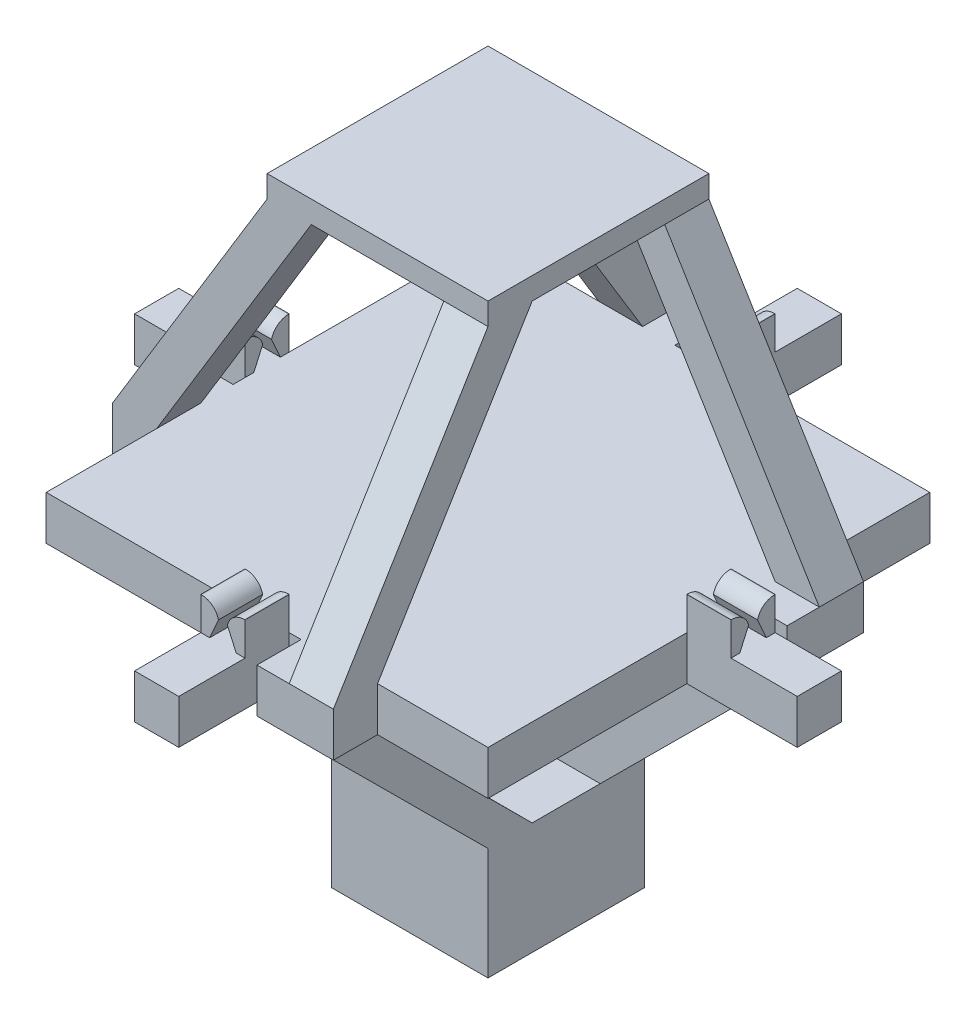
from build123d import *

# Parameters (mm, degrees)
SKETCH2_W            = 100
SKETCH2_H            = 100
BOSS_EXTRUDE1_DEPTH  = 5
SKETCH3_W            = 100
SKETCH3_H            = 100
BOSS_EXTRUDE2_DEPTH  = 5
SKETCH8_R            = 5
BOSS_EXTRUDE7_DEPTH  = 30
BOSS_EXTRUDE21_DEPTH = 10
FILLET14_R           = 4
FILLET13_R           = 4
SKETCH24_W           = 10
SKETCH24_H           = 10
BOSS_EXTRUDE22_DEPTH = 15
BOSS_EXTRUDE25_DEPTH = 10
SKETCH26_W           = 10
SKETCH26_H           = 10
BOSS_EXTRUDE26_DEPTH = 15
FILLET18_R           = 4
FILLET17_R           = 4
BOSS_EXTRUDE23_DEPTH = 10
SKETCH25_W           = 10
SKETCH25_H           = 10
BOSS_EXTRUDE24_DEPTH = 15
FILLET15_R           = 4
FILLET16_R           = 4
BOSS_EXTRUDE10_DEPTH = 10
FILLET19_R           = 4
SKETCH27_W           = 10
SKETCH27_H           = 10
BOSS_EXTRUDE27_DEPTH = 15
FILLET20_R           = 4
SKETCH62_R           = 11.223510807
CUT_EXTRUDE3_DEPTH   = 30
SKETCH64_W           = 35.4
SKETCH64_H           = 35.4
BOSS_EXTRUDE53_DEPTH = 25.4
SKETCH66_W           = 25.4
SKETCH66_H           = 25.4
CUT_EXTRUDE4_DEPTH   = 12.7
SKETCH67_W           = 50
SKETCH67_H           = 50
BOSS_EXTRUDE54_DEPTH = 5
SKETCH68_W           = 17.3
SKETCH68_H           = 10
BOSS_EXTRUDE55_DEPTH = 10
SKETCH70_W           = 17.3
SKETCH70_H           = 10
BOSS_EXTRUDE57_DEPTH = 10
SKETCH74_W           = 17.3
SKETCH74_H           = 10
BOSS_EXTRUDE58_DEPTH = 10
BOSS_EXTRUDE59_DEPTH = 10
BOSS_EXTRUDE60_DEPTH = 10
BOSS_EXTRUDE61_DEPTH = 10
BOSS_EXTRUDE62_DEPTH = 10
BOSS_EXTRUDE63_DEPTH = 10
BOSS_EXTRUDE64_DEPTH = 10
SKETCH85_W           = 17.3
SKETCH85_H           = 10
BOSS_EXTRUDE65_DEPTH = 10
BOSS_EXTRUDE66_DEPTH = 10
BOSS_EXTRUDE67_DEPTH = 10


with BuildPart() as part:
    # Sketch2 → Boss-Extrude1 (new body)
    with BuildSketch(Plane(origin=(0, 0, 0), x_dir=(1, 0, 0), z_dir=(0, 1, 0))):
        Rectangle(SKETCH2_W, SKETCH2_H)
    extrude(amount=BOSS_EXTRUDE1_DEPTH)

    # Sketch3 → Boss-Extrude2 (add)
    with BuildSketch(Plane.XZ):
        Rectangle(SKETCH3_W, SKETCH3_H)
    extrude(amount=BOSS_EXTRUDE2_DEPTH)

    # Sketch8 → Boss-Extrude7 (add)
    with BuildSketch(Plane.XZ.offset(5)):
        with Locations(Location((0, 0, 0), (0, 0, 90))):
            Circle(SKETCH8_R)
    extrude(amount=BOSS_EXTRUDE7_DEPTH)

    # Sketch11 → Boss-Extrude21 (add)
    with BuildSketch(Plane(origin=(50, 0, 0), x_dir=(0, 0, -1), z_dir=(1, 0, 0))):
        Polygon((5, -5), (5, 12.5), (1, 12.5), (1, 9.5), (3, 5), (-3, 5), (-1, 9.5), (-1, 12.5), (-5, 12.5), (-5, -5), align=None)
    extrude(amount=BOSS_EXTRUDE21_DEPTH)

    # Fillet14
    # the kernel refuses this fillet: 4 mm, written as the material it takes off along each edge
    with BuildSketch(Plane(origin=(40.317541634, 12.5, -1), x_dir=(0, -1, 0), z_dir=(1, 0, 0))) as fillet14_piece_1:
        with BuildLine():
            CenterArc((4, 3.872983346), FILLET14_R, 180, 75.522487814)
            Line((0, 3.872983346), (-0.08, 3.872983346))
            Line((-0.08, 3.872983346), (-0.08, 0))
            Line((-0.08, 0), (0, -0.08))
            ThreePointArc((0, -0.08), (1.5, -0.08), (2.98, -0.077459667))
            Line((2.98, -0.077459667), (3, 0))
        make_face()
    extrude(amount=29.364916731, mode=Mode.SUBTRACT)

    # Fillet13
    # the kernel refuses this fillet: 4 mm, written as the material it takes off along each edge
    with BuildSketch(Plane(origin=(40.317541634, 12.5, 1), x_dir=(0, 0, 1), z_dir=(1, 0, 0))) as fillet13_piece_1:
        with BuildLine():
            CenterArc((3.872983346, 4), FILLET13_R, 194.477512186, 75.522487814)
            Line((0, 3), (-0.077459667, 2.98))
            ThreePointArc((-0.077459667, 2.98), (-0.08, 1.5), (-0.08, 0))
            Line((-0.08, 0), (0, -0.08))
            Line((0, -0.08), (3.872983346, -0.08))
            Line((3.872983346, -0.08), (3.872983346, 0))
        make_face()
    extrude(amount=29.364916731, mode=Mode.SUBTRACT)

    # Sketch24 → Boss-Extrude22 (add)
    with BuildSketch(Plane(origin=(60, 0, 0), x_dir=(0, 0, -1), z_dir=(1, 0, 0))):
        Rectangle(SKETCH24_W, SKETCH24_H)
    extrude(amount=BOSS_EXTRUDE22_DEPTH)

    # Sketch13 → Boss-Extrude25 (add)
    with BuildSketch(Plane.ZY.offset(50)):
        Polygon((-5, 12.5), (-5, -5), (5, -5), (5, 12.5), (1, 12.5), (1, 9.5), (3, 5), (-3, 5), (-1, 9.5), (-1, 12.5), align=None)
    extrude(amount=BOSS_EXTRUDE25_DEPTH)

    # Sketch26 → Boss-Extrude26 (add)
    with BuildSketch(Plane.ZY.offset(60)):
        Rectangle(SKETCH26_W, SKETCH26_H)
    extrude(amount=BOSS_EXTRUDE26_DEPTH)

    # Fillet18
    # the kernel refuses this fillet: 4 mm, written as the material it takes off along each edge
    with BuildSketch(Plane(origin=(-40.317541634, 12.5, 1), x_dir=(0, -1, 0), z_dir=(-1, 0, 0))) as fillet18_piece_1:
        with BuildLine():
            CenterArc((4, 3.872983346), FILLET18_R, 180, 75.522487814)
            Line((0, 3.872983346), (-0.08, 3.872983346))
            Line((-0.08, 3.872983346), (-0.08, 0))
            Line((-0.08, 0), (0, -0.08))
            ThreePointArc((0, -0.08), (1.5, -0.08), (2.98, -0.077459667))
            Line((2.98, -0.077459667), (3, 0))
        make_face()
    extrude(amount=29.364916731, mode=Mode.SUBTRACT)

    # Fillet17
    # the kernel refuses this fillet: 4 mm, written as the material it takes off along each edge
    with BuildSketch(Plane(origin=(-40.317541634, 12.5, -1), x_dir=(0, 0, -1), z_dir=(-1, 0, 0))) as fillet17_piece_1:
        with BuildLine():
            CenterArc((3.872983346, 4), FILLET17_R, 194.477512186, 75.522487814)
            Line((0, 3), (-0.077459667, 2.98))
            ThreePointArc((-0.077459667, 2.98), (-0.08, 1.5), (-0.08, 0))
            Line((-0.08, 0), (0, -0.08))
            Line((0, -0.08), (3.872983346, -0.08))
            Line((3.872983346, -0.08), (3.872983346, 0))
        make_face()
    extrude(amount=29.364916731, mode=Mode.SUBTRACT)

    # Sketch14 → Boss-Extrude23 (add)
    with BuildSketch(Plane(origin=(0, 0, -50), x_dir=(-1, 0, 0), z_dir=(0, 0, -1))):
        Polygon((-5, 12.5), (-1, 12.5), (-1, 9.5), (-3, 5), (3, 5), (1, 9.5), (1, 12.5), (5, 12.5), (5, -5), (-5, -5), align=None)
    extrude(amount=BOSS_EXTRUDE23_DEPTH)

    # Sketch25 → Boss-Extrude24 (add)
    with BuildSketch(Plane(origin=(0, 0, -60), x_dir=(-1, 0, 0), z_dir=(0, 0, -1))):
        Rectangle(SKETCH25_W, SKETCH25_H)
    extrude(amount=BOSS_EXTRUDE24_DEPTH)

    # Fillet15
    # the kernel refuses this fillet: 4 mm, written as the material it takes off along each edge
    with BuildSketch(Plane(origin=(-1, 12.5, -40.317541634), x_dir=(0, -1, 0), z_dir=(0, 0, -1))) as fillet15_piece_1:
        with BuildLine():
            CenterArc((4, 3.872983346), FILLET15_R, 180, 75.522487814)
            Line((0, 3.872983346), (-0.08, 3.872983346))
            Line((-0.08, 3.872983346), (-0.08, 0))
            Line((-0.08, 0), (0, -0.08))
            ThreePointArc((0, -0.08), (1.5, -0.08), (2.98, -0.077459667))
            Line((2.98, -0.077459667), (3, 0))
        make_face()
    extrude(amount=29.364916731, mode=Mode.SUBTRACT)

    # Fillet16
    # the kernel refuses this fillet: 4 mm, written as the material it takes off along each edge
    with BuildSketch(Plane(origin=(1, 12.5, -40.317541634), x_dir=(0, -1, 0), z_dir=(0, 0, -1))) as fillet16_piece_1:
        with BuildLine():
            CenterArc((4, -3.872983346), FILLET16_R, 104.477512186, 75.522487814)
            Line((0, -3.872983346), (-0.08, -3.872983346))
            Line((-0.08, -3.872983346), (-0.08, 0))
            Line((-0.08, 0), (0, 0.08))
            ThreePointArc((0, 0.08), (1.5, 0.08), (2.98, 0.077459667))
            Line((2.98, 0.077459667), (3, 0))
        make_face()
    extrude(amount=29.364916731, mode=Mode.SUBTRACT)

    # Sketch12 → Boss-Extrude10 (add)
    with BuildSketch(Plane.XY.offset(50)):
        Polygon((-5, 12.5), (-5, -5), (5, -5), (5, 12.5), (1, 12.5), (1, 9.5), (3, 5), (-3, 5), (-1, 9.5), (-1, 12.5), align=None)
    extrude(amount=BOSS_EXTRUDE10_DEPTH)

    # Fillet19
    # the kernel refuses this fillet: 4 mm, written as the material it takes off along each edge
    with BuildSketch(Plane(origin=(-1, 12.5, 40.317541634), x_dir=(-1, 0, 0), z_dir=(0, 0, 1))) as fillet19_piece_1:
        with BuildLine():
            CenterArc((3.872983346, 4), FILLET19_R, 194.477512186, 75.522487814)
            Line((0, 3), (-0.077459667, 2.98))
            ThreePointArc((-0.077459667, 2.98), (-0.08, 1.5), (-0.08, 0))
            Line((-0.08, 0), (0, -0.08))
            Line((0, -0.08), (3.872983346, -0.08))
            Line((3.872983346, -0.08), (3.872983346, 0))
        make_face()
    extrude(amount=29.364916731, mode=Mode.SUBTRACT)

    # Sketch27 → Boss-Extrude27 (add)
    with BuildSketch(Plane.XY.offset(60)):
        Rectangle(SKETCH27_W, SKETCH27_H)
    extrude(amount=BOSS_EXTRUDE27_DEPTH)

    # Fillet20
    # the kernel refuses this fillet: 4 mm, written as the material it takes off along each edge
    with BuildSketch(Plane(origin=(1, 12.5, 40.317541634), x_dir=(1, 0, 0), z_dir=(0, 0, 1))) as fillet20_piece_1:
        with BuildLine():
            CenterArc((3.872983346, -4), FILLET20_R, 90, 75.522487814)
            Line((0, -3), (-0.077459667, -2.98))
            ThreePointArc((-0.077459667, -2.98), (-0.08, -1.5), (-0.08, 0))
            Line((-0.08, 0), (0, 0.08))
            Line((0, 0.08), (3.872983346, 0.08))
            Line((3.872983346, 0.08), (3.872983346, 0))
        make_face()
    extrude(amount=29.364916731, mode=Mode.SUBTRACT)

    # Sketch62 → Cut-Extrude3 (cut)
    with BuildSketch(Plane.XZ.offset(5)):
        Circle(SKETCH62_R)
    extrude(amount=CUT_EXTRUDE3_DEPTH, mode=Mode.SUBTRACT)

    # Sketch68 → Boss-Extrude55 (add)
    with BuildSketch(Plane.XY.offset(50)):
        with Locations((16.35, 0)):
            Rectangle(SKETCH68_W, SKETCH68_H)
    extrude(amount=BOSS_EXTRUDE55_DEPTH)

    # Sketch70 → Boss-Extrude57 (add)
    with BuildSketch(Plane(origin=(0, 0, -50), x_dir=(-1, 0, 0), z_dir=(0, 0, -1))):
        with Locations((16.35, 0)):
            Rectangle(SKETCH70_W, SKETCH70_H)
    extrude(amount=BOSS_EXTRUDE57_DEPTH)

    # Sketch74 → Boss-Extrude58 (add)
    with BuildSketch(Plane.ZY.offset(50)):
        with Locations((16.35, 0)):
            Rectangle(SKETCH74_W, SKETCH74_H)
    extrude(amount=BOSS_EXTRUDE58_DEPTH)



with BuildPart() as body_2:
    # Sketch64 → Boss-Extrude53 (new body)
    with BuildSketch(Plane(origin=(0, -72.5, 0), x_dir=(1, 0, 0), z_dir=(0, 1, 0))):
        Rectangle(SKETCH64_W, SKETCH64_H)
    extrude(amount=BOSS_EXTRUDE53_DEPTH)

    # Sketch66 → Cut-Extrude4 (cut)
    with BuildSketch(Plane(origin=(0, -72.5, 0), x_dir=(-1, 0, 0), z_dir=(0, -1, 0))):
        Rectangle(SKETCH66_W, SKETCH66_H)
    extrude(amount=-CUT_EXTRUDE4_DEPTH, mode=Mode.SUBTRACT)


with BuildPart() as body_3:
    # Sketch67 → Boss-Extrude54 (new body)
    with BuildSketch(Plane(origin=(0, 67.5, 0), x_dir=(1, 0, 0), z_dir=(0, 1, 0))):
        Rectangle(SKETCH67_W, SKETCH67_H)
    extrude(amount=-BOSS_EXTRUDE54_DEPTH)


with BuildPart() as part_1:
    add(part.part)

    add(body_2.part)  # Boss-Extrude59 merges body 2
    # Sketch76 → Boss-Extrude59 (add)
    with BuildSketch(Plane.ZY.offset(17.7)):
        Polygon((-17.7, -47.1), (-60, -5), (-50, -5), (-7.7, -47.1), align=None)
    extrude(amount=-BOSS_EXTRUDE59_DEPTH)


    add(body_3.part)  # Boss-Extrude60 merges body 3
    # Sketch77 → Boss-Extrude60 (add)
    with BuildSketch(Plane.ZY.offset(25)):
        Polygon((-25, 62.5), (-60, 5), (-50, 5), (-15, 62.5), align=None)
    extrude(amount=-BOSS_EXTRUDE60_DEPTH)

    # Sketch78 → Boss-Extrude61 (add)
    with BuildSketch(Plane.XY.offset(17.7)):
        Polygon((-17.7, -47.1), (-60, -5), (-50, -5), (-7.7, -47.1), align=None)
    extrude(amount=-BOSS_EXTRUDE61_DEPTH)

    # Sketch79 → Boss-Extrude62 (add)
    with BuildSketch(Plane.XY.offset(25)):
        Polygon((-25, 62.5), (-60, 5), (-50, 5), (-15, 62.5), align=None)
    extrude(amount=-BOSS_EXTRUDE62_DEPTH)

    # Sketch82 → Boss-Extrude63 (add)
    with BuildSketch(Plane(origin=(17.7, 0, 0), x_dir=(0, 0, -1), z_dir=(1, 0, 0))):
        Polygon((-60, -5), (-17.7, -47.1), (-7.7, -47.1), (-50, -5), align=None)
    extrude(amount=-BOSS_EXTRUDE63_DEPTH)

    # Sketch83 → Boss-Extrude64 (add)
    with BuildSketch(Plane(origin=(25, 0, 0), x_dir=(0, 0, -1), z_dir=(1, 0, 0))):
        Polygon((-25, 62.5), (-60, 5), (-50, 5), (-15, 62.5), align=None)
    extrude(amount=-BOSS_EXTRUDE64_DEPTH)

    # Sketch85 → Boss-Extrude65 (add)
    with BuildSketch(Plane(origin=(50, 0, 0), x_dir=(0, 0, -1), z_dir=(1, 0, 0))):
        with Locations((16.35, 0)):
            Rectangle(SKETCH85_W, SKETCH85_H)
    extrude(amount=BOSS_EXTRUDE65_DEPTH)

    # Sketch86 → Boss-Extrude66 (add)
    with BuildSketch(Plane(origin=(0, 0, -25), x_dir=(-1, 0, 0), z_dir=(0, 0, -1))):
        Polygon((-25, 62.5), (-60, 5), (-50, 5), (-15, 62.5), align=None)
    extrude(amount=-BOSS_EXTRUDE66_DEPTH)

    # Sketch89 → Boss-Extrude67 (add)
    with BuildSketch(Plane(origin=(0, 0, -17.7), x_dir=(-1, 0, 0), z_dir=(0, 0, -1))):
        Polygon((-60, -5), (-50, -5), (-7.7, -47.1), (-17.7, -47.1), align=None)
    extrude(amount=-BOSS_EXTRUDE67_DEPTH)


solid = part_1.part
